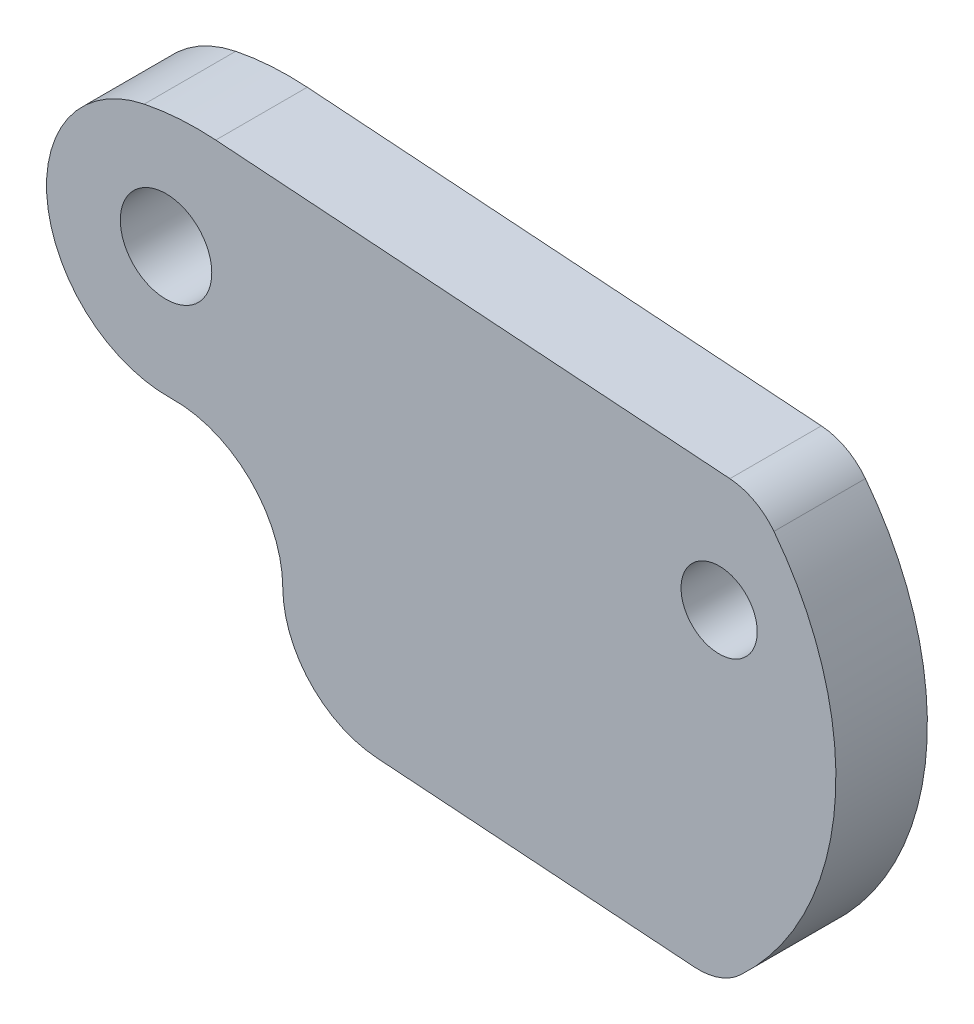
from build123d import *

# Parameters (mm, degrees)
ESQUISSE1_R               = 1.5
ESQUISSE1_R_2             = 1.25
T_LE_DE_BASE_PLI_E1_DEPTH = 3


# Sheet-metal steps are written as plain solids
with BuildPart() as part:
    # Esquisse1 → Tôle de base pliée1 (new body)
    with BuildSketch(Plane.XY):
        with BuildLine():
            Line((1180.806329324, 1712.423223535), (1163.94410285, 1713.60971993))
            ThreePointArc((1163.94410285, 1713.60971993), (1162.76612345, 1713.612955968), (1161.59842695, 1713.457614973))
            ThreePointArc((1161.59842695, 1713.457614973), (1158.418396897, 1709.091687704), (1162.488835778, 1705.54127373))
            ThreePointArc((1162.488835778, 1705.54127373), (1165.059310496, 1704.535149371), (1166.141947966, 1701.995952134))
            ThreePointArc((1166.141947966, 1701.995952134), (1167.040054527, 1699.743489734), (1169.229884323, 1698.701939096))
            Line((1169.229884323, 1698.701939096), (1179.646505762, 1697.968982283))
            ThreePointArc((1179.646505762, 1697.968982283), (1180.450889379, 1698.077491546), (1181.145910596, 1698.496720327))
            ThreePointArc((1181.145910596, 1698.496720327), (1184.248383676, 1704.858228491), (1182.250729268, 1711.648184471))
            ThreePointArc((1182.250729268, 1711.648184471), (1181.611578951, 1712.190479321), (1180.806329324, 1712.423223535))
        make_face()
        with Locations((1162.31301042, 1709.771535786)):
            Circle(ESQUISSE1_R, mode=Mode.SUBTRACT)
        with Locations((1180.453067935, 1708.517601578)):
            Circle(ESQUISSE1_R_2, mode=Mode.SUBTRACT)
    extrude(amount=-T_LE_DE_BASE_PLI_E1_DEPTH)


solid = part.part
